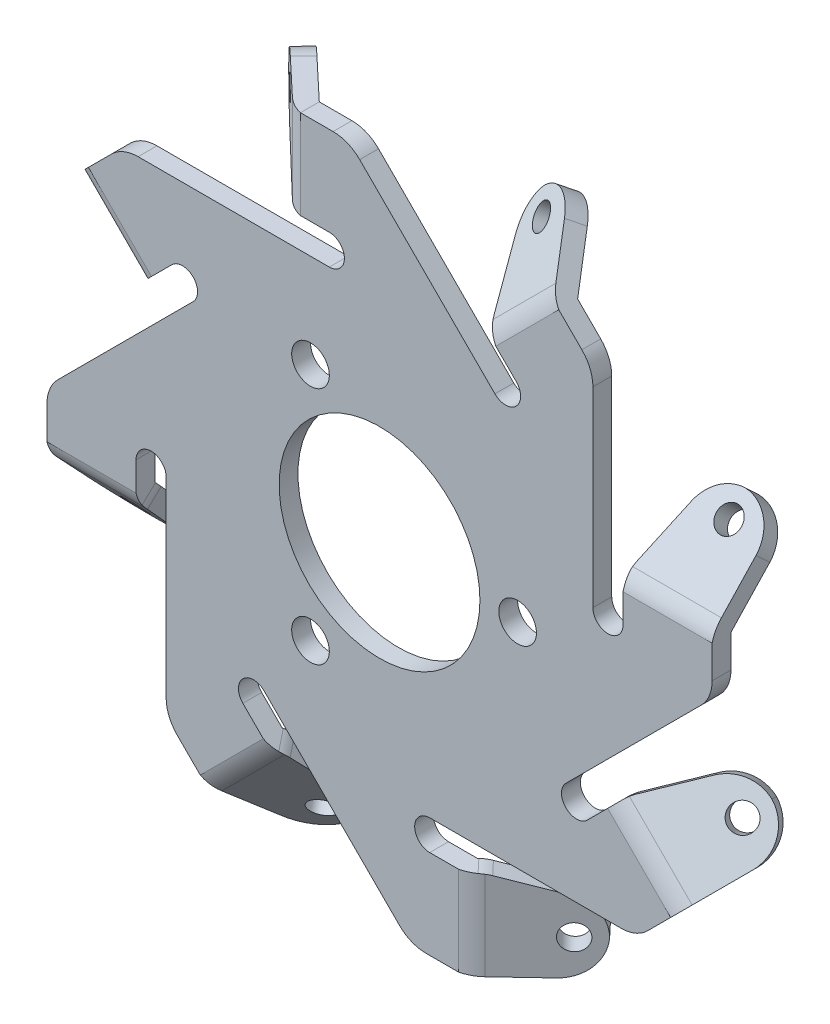
from build123d import *

# Parameters (mm, degrees)
ESQUISSE1_W                    = 53
ESQUISSE1_H                    = 53
BOSS_EXTRU_1_DEPTH             = 1.5
ESQUISSE5_R                    = 8
ENL_V_MAT_EXTRU_4_DEPTH        = 38.506666074
ENL_V_MAT_EXTRU_1_DEPTH        = 38.506666074
ESQUISSE3_W                    = 15
ESQUISSE3_H                    = 20.2
ESQUISSE3_W_2                  = 20.2
ESQUISSE3_H_2                  = 15
ENL_V_MAT_EXTRU_2_DEPTH        = 38.506666074
ENL_V_MAT_EXTRU_3_DEPTH        = 1.5
BOSS_EXTRU_2_DEPTH             = 7.1
R_P_TITION_CIRCULAIRE6_COUNT   = 8
ESQUISSE14_R                   = 1
ENL_V_MAT_EXTRU_5_DEPTH        = 44.23397886
R_P_TITION_CIRCULAIRE7_COUNT   = 8
CONG_1_R                       = 3
R_P_TITION_START               = -5.820655623
R_P_TITION_CIRCULAIRE8_DEPTH   = 1.5
R_P_TITION_CIRCULAIRE8_2_DEPTH = 1.5
R_P_TITION_START_2             = 4.320655623
R_P_TITION_CIRCULAIRE8_3_DEPTH = 1.5
R_P_TITION_CIRCULAIRE8_4_DEPTH = 1.5
R_P_TITION_CIRCULAIRE8_5_DEPTH = 1.5
R_P_TITION_CIRCULAIRE8_6_DEPTH = 1.5
R_P_TITION_CIRCULAIRE8_7_DEPTH = 1.5
CONG_2_R                       = 3
R_P_TITION_START_3             = -26.5
R_P_TITION_CIRCULAIRE9_DEPTH   = 7.1
R_P_TITION_START_4             = 19.4
R_P_TITION_CIRCULAIRE9_2_DEPTH = 7.1
R_P_TITION_CIRCULAIRE9_3_DEPTH = 7.1
R_P_TITION_CIRCULAIRE9_4_DEPTH = 7.1
R_P_TITION_CIRCULAIRE9_5_DEPTH = 7.1
R_P_TITION_CIRCULAIRE9_6_DEPTH = 7.1
R_P_TITION_CIRCULAIRE9_7_DEPTH = 7.1
CONG_3_R                       = 3
R_P_TITION_CIRCULAIRE10_DEPTH  = 1.5
ESQUISSE15_R                   = 1.5
ENL_V_MAT_EXTRU_6_DEPTH        = 39.393130179


# Read off the part's stored shape, not the designer's step: Répétition circulaire8, Répétition circulaire9, Répétition circulaire10
with BuildPart() as part:
    # Esquisse1 → Boss.-Extru.1 (new body)
    with BuildSketch(Plane.XY):
        Rectangle(ESQUISSE1_W, ESQUISSE1_H)
    extrude(amount=BOSS_EXTRU_1_DEPTH)

    # Esquisse5 → Enlèv. mat.-Extru.4 (cut, through all)
    with BuildSketch(Plane.XY.offset(1.5)):
        Circle(ESQUISSE5_R)
    extrude(amount=-ENL_V_MAT_EXTRU_4_DEPTH, mode=Mode.SUBTRACT)

    # Esquisse2 → Enlèv. mat.-Extru.1 (cut, through all)
    with BuildSketch(Plane.XY.offset(1.5)):
        with BuildLine():
            Line((19.4, 26.5), (19.4, 4))
            ThreePointArc((19.4, 4), (18.2, 2.8), (17, 4))
            Line((17, 4), (17, 26.5))
            ThreePointArc((17, 26.5), (18.2, 27.7), (19.4, 26.5))
        make_face()
        with BuildLine():
            Line((32.456201256, 5.020458146), (16.54629868, -10.88944443))
            ThreePointArc((16.54629868, -10.88944443), (14.849242405, -10.88944443), (14.849242405, -9.192388155))
            Line((14.849242405, -9.192388155), (30.759144982, 6.717514421))
            ThreePointArc((30.759144982, 6.717514421), (32.456201256, 6.717514421), (32.456201256, 5.020458146))
        make_face()
        with BuildLine():
            Line((26.5, -19.4), (4, -19.4))
            ThreePointArc((4, -19.4), (2.8, -18.2), (4, -17))
            Line((4, -17), (26.5, -17))
            ThreePointArc((26.5, -17), (27.7, -18.2), (26.5, -19.4))
        make_face()
        with BuildLine():
            Line((5.020458146, -32.456201256), (-10.88944443, -16.54629868))
            ThreePointArc((-10.88944443, -16.54629868), (-10.88944443, -14.849242405), (-9.192388155, -14.849242405))
            Line((-9.192388155, -14.849242405), (6.717514421, -30.759144982))
            ThreePointArc((6.717514421, -30.759144982), (6.717514421, -32.456201256), (5.020458146, -32.456201256))
        make_face()
        with BuildLine():
            Line((-19.4, -26.5), (-19.4, -4))
            ThreePointArc((-19.4, -4), (-18.2, -2.8), (-17, -4))
            Line((-17, -4), (-17, -26.5))
            ThreePointArc((-17, -26.5), (-18.2, -27.7), (-19.4, -26.5))
        make_face()
        with BuildLine():
            Line((-32.456201256, -5.020458146), (-16.54629868, 10.88944443))
            ThreePointArc((-16.54629868, 10.88944443), (-14.849242405, 10.88944443), (-14.849242405, 9.192388155))
            Line((-14.849242405, 9.192388155), (-30.759144982, -6.717514421))
            ThreePointArc((-30.759144982, -6.717514421), (-32.456201256, -6.717514421), (-32.456201256, -5.020458146))
        make_face()
        with BuildLine():
            Line((-26.5, 19.4), (-4, 19.4))
            ThreePointArc((-4, 19.4), (-2.8, 18.2), (-4, 17))
            Line((-4, 17), (-26.5, 17))
            ThreePointArc((-26.5, 17), (-27.7, 18.2), (-26.5, 19.4))
        make_face()
        with BuildLine():
            Line((-5.020458146, 32.456201256), (10.88944443, 16.54629868))
            ThreePointArc((10.88944443, 16.54629868), (10.88944443, 14.849242405), (9.192388155, 14.849242405))
            Line((9.192388155, 14.849242405), (-6.717514421, 30.759144982))
            ThreePointArc((-6.717514421, 30.759144982), (-6.717514421, 32.456201256), (-5.020458146, 32.456201256))
        make_face()
    extrude(amount=-ENL_V_MAT_EXTRU_1_DEPTH, mode=Mode.SUBTRACT)

    # Esquisse3 → Enlèv. mat.-Extru.2 (cut, through all)
    with BuildSketch(Plane.XY.offset(1.5)):
        with Locations((26.9, 16.4)):
            Rectangle(ESQUISSE3_W, ESQUISSE3_H)
        Polygon((18.172644276, -9.263098834), (28.779245994, -19.869700551), (43.062802974, -5.586143571), (32.456201256, 5.020458146), align=None)
        with Locations((16.4, -26.9)):
            Rectangle(ESQUISSE3_W_2, ESQUISSE3_H_2)
        Polygon((-9.263098834, -18.172644276), (-19.869700551, -28.779245994), (-5.586143571, -43.062802974), (5.020458146, -32.456201256), align=None)
        with Locations((-26.9, -16.4)):
            Rectangle(ESQUISSE3_W, ESQUISSE3_H)
        Polygon((-18.172644276, 9.263098834), (-28.779245994, 19.869700551), (-43.062802974, 5.586143571), (-32.456201256, -5.020458146), align=None)
        with Locations((-16.4, 26.9)):
            Rectangle(ESQUISSE3_W_2, ESQUISSE3_H_2)
        Polygon((9.263098834, 18.172644276), (19.869700551, 28.779245994), (5.586143571, 43.062802974), (-5.020458146, 32.456201256), align=None)
    extrude(amount=-ENL_V_MAT_EXTRU_2_DEPTH, mode=Mode.SUBTRACT)

    # Esquisse4 → Enlèv. mat.-Extru.3 (cut)
    with BuildSketch(Plane.XY.offset(1.5)):
        Polygon((14.28355698, 23.193102423), (18.526197667, 18.950461736), (22.768838354, 23.193102423), (18.526197667, 27.43574311), align=None)
        Polygon((27.43574311, -18.526197667), (23.193102423, -14.28355698), (18.950461736, -18.526197667), (23.193102423, -22.768838354), align=None)
        Polygon((-18.526197667, -27.43574311), (-14.28355698, -23.193102423), (-18.526197667, -18.950461736), (-22.768838354, -23.193102423), align=None)
        Polygon((-27.43574311, 18.526197667), (-23.193102423, 14.28355698), (-18.950461736, 18.526197667), (-23.193102423, 22.768838354), align=None)
    extrude(amount=-ENL_V_MAT_EXTRU_3_DEPTH, mode=Mode.SUBTRACT)


with BuildPart() as body_2:
    # Esquisse6 → Boss.-Extru.2 (new body)
    with BuildSketch(Plane(origin=(0, 26.5, 0), x_dir=(1, 0, 0), z_dir=(0, 1, 0))):
        Polygon((-6.3, 0), (-11.758295682, 5.143637647), (-12.787023212, 4.05197851), (-6.895406731, -1.5), (-6.3, -1.5), align=None)
    boss_extru_2 = extrude(amount=-BOSS_EXTRU_2_DEPTH)

    # Esquisse14 → Enlèv. mat.-Extru.5 (cut, through all)
    with BuildSketch(Plane(origin=(-3.991912453, 0, 4.236114594), x_dir=(0.7277727576572095, 0, 0.6858183529273774), z_dir=(-0.6858183529273774, 0, 0.7277727576572095))):
        with Locations((-10.084968373, 23.664285714)):
            Circle(ESQUISSE14_R)
        Polygon((-5.084968373, 19.4), (-12.084968373, 21.4), (-12.084968373, 19.4), align=None)
    enl_v_mat_extru_5 = extrude(amount=-ENL_V_MAT_EXTRU_5_DEPTH, mode=Mode.SUBTRACT)

    # Congé1
    # the kernel refuses this fillet: 3 mm, written as the material it takes off along each edge
    with BuildSketch(Plane(origin=(-8.413005794, 19.4, 1.51321126), x_dir=(-0.6997709349280078, 0.2747211278973797, -0.6594307700712588), z_dir=(0.6858183529273774, 0, -0.7277727576572095))) as cong_1_piece_1:
        with BuildLine():
            CenterArc((CONG_1_R * 0.14005494464, CONG_1_R), CONG_1_R, 254.054604099, 15.945395901)
            Line((-CONG_1_R * 0.134666183257, CONG_1_R * 0.0384760523592), (0, 0))
            Line((0, 0), (CONG_1_R * 0.14005494464, 0))
        make_face()
    extrude(amount=3.60082417, mode=Mode.SUBTRACT)
    with BuildSketch(Plane(origin=(-6.614658035, 26.5, -10.601933329), x_dir=(0.7277727576572104, 0, 0.6858183529273763), z_dir=(-0.6858183529273764, 0, 0.7277727576572105))) as cong_1_piece_2:
        with BuildLine():
            CenterArc((CONG_1_R, -CONG_1_R), CONG_1_R, 90, 90)
            Line((0, -CONG_1_R), (0, 0))
            Line((0, 0), (CONG_1_R, 0))
        make_face()
    extrude(amount=16.5, mode=Mode.SUBTRACT)
    with BuildSketch(Plane(origin=(-16.666876356, 21.4, 0.065221634), x_dir=(0, 1, 0), z_dir=(0.6858183529273774, 0, -0.7277727576572095))) as cong_1_piece_3:
        with BuildLine():
            CenterArc((CONG_1_R * 0.754301412754, CONG_1_R), CONG_1_R, 195.945395901, 74.054604099)
            Line((-CONG_1_R * 0.207222534886, CONG_1_R * 0.725278872103), (0, 0))
            Line((0, 0), (CONG_1_R * 0.754301412754, 0))
        make_face()
    extrude(amount=12.814521191, mode=Mode.SUBTRACT)

    # Congé2
    # the kernel refuses this fillet: 3 mm, written as the material it takes off along each edge
    with BuildSketch(Plane(origin=(-6.895406731, 29.194348497, 1.5), x_dir=(1, 0, 0), z_dir=(0, -1, 0))) as cong_2_piece_1:
        with BuildLine():
            CenterArc((1.273105684, -2.922451732), CONG_2_R, 103.055786516, 30.244213484)
            Line((-0.784349374, -0.739133459), (-0.825498476, -0.695467094))
            Line((-0.825498476, -0.695467094), (-0.041149101, 0.043666365))
            Line((-0.041149101, 0.043666365), (0, 0.06))
            ThreePointArc((0, 0.06), (0.297703365, 0.06), (0.581852752, 0.058449035))
            Line((0.581852752, 0.058449035), (0.595406731, 0))
        make_face()
    extrude(amount=12.488696995, mode=Mode.SUBTRACT)


with BuildPart() as part_1:
    add(part.part)

    # Répétition circulaire6: Boss.-Extru.2 ×8 about axis
    r_p_tition_circulaire6_axis = Axis((0, 0, 0), (0, 0, 1))
    for i in range(1, R_P_TITION_CIRCULAIRE6_COUNT):
        add(boss_extru_2.rotate(r_p_tition_circulaire6_axis, i * 360 / R_P_TITION_CIRCULAIRE6_COUNT))

    # Répétition circulaire7: Enlèv. mat.-Extru.5 ×8 about axis
    r_p_tition_circulaire7_axis = Axis((0, 0, 0), (0, 0, 1))
    for i in range(1, R_P_TITION_CIRCULAIRE7_COUNT):
        add(enl_v_mat_extru_5.rotate(r_p_tition_circulaire7_axis, i * 360 / R_P_TITION_CIRCULAIRE7_COUNT), mode=Mode.SUBTRACT)

    # Répétition circulaire8 outline → Répétition circulaire8 (cut)
    with BuildSketch(Plane(origin=(0, 0, 0), x_dir=(0.8745436486499637, -0.26890985597922773, 0.40356027550198764), z_dir=(0.4849468080171361, 0.4849468080171381, -0.7277727576572101)).offset(R_P_TITION_START)):
        with BuildLine():
            ThreePointArc((-26.177216042, -4.105846504), (-24.386324296, -3.579926665), (-22.631081143, -4.214754514))
            Line((-22.631081143, -4.214754514), (-24.414067393, -2.821307126))
            Line((-24.414067393, -2.821307126), (-28.537640401, -5.822331225))
            Line((-28.537640401, -5.822331225), (-26.772332108, -8.247962407))
            ThreePointArc((-26.772332108, -8.247962407), (-27.316208691, -6.056011832), (-26.177216042, -4.105846504))
        make_face()
        with BuildLine():
            Line((-18.677927253, -7.30424102), (-19.008983296, -7.045512621))
            ThreePointArc((-19.008983296, -7.045512621), (-18.698982985, -7.324587663), (-18.430687098, -7.64396266))
            Line((-18.430687098, -7.64396266), (-18.677927253, -7.30424102))
        make_face()
    extrude(amount=R_P_TITION_CIRCULAIRE8_DEPTH, mode=Mode.SUBTRACT)

    # R_p_tition circulaire8 2 outline → R_p_tition circulaire8 2 (cut)
    with BuildSketch(Plane(origin=(0, 0, 0), x_dir=(1, 0, 0), z_dir=(0, 0.6858183529273764, -0.7277727576572104)).offset(R_P_TITION_START)):
        with BuildLine():
            ThreePointArc((-23.581452119, 12.083862428), (-21.823967614, 11.455266264), (-20.778332395, 9.909131757))
            Line((-20.778332395, 9.909131757), (-21.4, 12.084968373))
            Line((-21.4, 12.084968373), (-26.5, 12.084968373))
            Line((-26.5, 12.084968373), (-26.5, 9.084968373))
            ThreePointArc((-26.5, 9.084968373), (-25.649925157, 11.177292875), (-23.581452119, 12.083862428))
        make_face()
        with BuildLine():
            Line((-19.4, 5.084968373), (-19.515428157, 5.488966923))
            ThreePointArc((-19.515428157, 5.488966923), (-19.428997179, 5.080907175), (-19.4, 4.664803539))
            Line((-19.4, 4.664803539), (-19.4, 5.084968373))
        make_face()
    extrude(amount=R_P_TITION_CIRCULAIRE8_2_DEPTH, mode=Mode.SUBTRACT)

    # R_p_tition circulaire8 3 outline → R_p_tition circulaire8 3 (cut)
    with BuildSketch(Plane(origin=(0, 0, 0), x_dir=(0.8745436486499614, 0.26890985597922834, -0.40356027550199197), z_dir=(0.4849468080171401, -0.4849468080171341, 0.7277727576572101)).offset(R_P_TITION_START_2)):
        with BuildLine():
            Line((-10.191604126, -22.363757867), (-10.969299493, -20.23868716))
            ThreePointArc((-10.969299493, -20.23868716), (-10.904939933, -22.104094024), (-11.956054331, -23.646508834))
            ThreePointArc((-11.956054331, -23.646508834), (-14.16196348, -24.130671912), (-16.080485428, -22.939150785))
            Line((-16.080485428, -22.939150785), (-14.315177135, -25.364781966))
            Line((-14.315177135, -25.364781966), (-10.191604126, -22.363757867))
        make_face()
        with BuildLine():
            ThreePointArc((-12.940809513, -15.18735794), (-12.7194046, -15.540858911), (-12.54917074, -15.921652168))
            Line((-12.54917074, -15.921652168), (-12.693569358, -15.527079581))
            Line((-12.693569358, -15.527079581), (-12.940809513, -15.18735794))
        make_face()
    extrude(amount=R_P_TITION_CIRCULAIRE8_3_DEPTH, mode=Mode.SUBTRACT)

    # R_p_tition circulaire8 4 outline → R_p_tition circulaire8 4 (cut)
    with BuildSketch(Plane(origin=(0, 0, 0), x_dir=(0.7277727576572104, 0, -0.6858183529273765), z_dir=(0.6858183529273764, 0, 0.7277727576572104)).offset(R_P_TITION_START_2)):
        with BuildLine():
            Line((12.084968373, -21.4), (9.909131757, -20.778332395))
            ThreePointArc((9.909131757, -20.778332395), (11.455266264, -21.823967614), (12.083862428, -23.581452119))
            ThreePointArc((12.083862428, -23.581452119), (11.177292875, -25.649925157), (9.084968373, -26.5))
            Line((9.084968373, -26.5), (12.084968373, -26.5))
            Line((12.084968373, -26.5), (12.084968373, -21.4))
        make_face()
        with BuildLine():
            ThreePointArc((4.664803539, -19.4), (5.080907175, -19.428997179), (5.488966923, -19.515428157))
            Line((5.488966923, -19.515428157), (5.084968373, -19.4))
            Line((5.084968373, -19.4), (4.664803539, -19.4))
        make_face()
    extrude(amount=R_P_TITION_CIRCULAIRE8_4_DEPTH, mode=Mode.SUBTRACT)

    # R_p_tition circulaire8 5 outline → R_p_tition circulaire8 5 (cut)
    with BuildSketch(Plane(origin=(0, 0, 0), x_dir=(0.8745436486499657, -0.26890985597922673, -0.4035602755019837), z_dir=(0.4849468080171323, 0.4849468080171413, 0.7277727576572104)).offset(R_P_TITION_START_2)):
        with BuildLine():
            Line((24.414067393, -2.821307126), (22.631081143, -4.214754514))
            ThreePointArc((22.631081143, -4.214754514), (24.386324296, -3.579926665), (26.177216042, -4.105846504))
            ThreePointArc((26.177216042, -4.105846504), (27.316208691, -6.056011832), (26.772332108, -8.247962407))
            Line((26.772332108, -8.247962407), (28.537640401, -5.822331225))
            Line((28.537640401, -5.822331225), (24.414067393, -2.821307126))
        make_face()
        with BuildLine():
            ThreePointArc((18.430687098, -7.64396266), (18.698982985, -7.324587663), (19.008983296, -7.045512621))
            Line((19.008983296, -7.045512621), (18.677927253, -7.30424102))
            Line((18.677927253, -7.30424102), (18.430687098, -7.64396266))
        make_face()
    extrude(amount=R_P_TITION_CIRCULAIRE8_5_DEPTH, mode=Mode.SUBTRACT)

    # R_p_tition circulaire8 6 outline → R_p_tition circulaire8 6 (cut)
    with BuildSketch(Plane(origin=(0, 0, 0), x_dir=(1, 0, 0), z_dir=(0, 0.6858183529273764, 0.7277727576572104)).offset(R_P_TITION_START_2)):
        with BuildLine():
            Line((21.4, 12.084968373), (20.778332395, 9.909131757))
            ThreePointArc((20.778332395, 9.909131757), (21.823967614, 11.455266264), (23.581452119, 12.083862428))
            ThreePointArc((23.581452119, 12.083862428), (25.649925157, 11.177292875), (26.5, 9.084968373))
            Line((26.5, 9.084968373), (26.5, 12.084968373))
            Line((26.5, 12.084968373), (21.4, 12.084968373))
        make_face()
        with BuildLine():
            ThreePointArc((19.4, 4.664803539), (19.428997179, 5.080907175), (19.515428157, 5.488966923))
            Line((19.515428157, 5.488966923), (19.4, 5.084968373))
            Line((19.4, 5.084968373), (19.4, 4.664803539))
        make_face()
    extrude(amount=R_P_TITION_CIRCULAIRE8_6_DEPTH, mode=Mode.SUBTRACT)

    # R_p_tition circulaire8 7 outline → R_p_tition circulaire8 7 (cut)
    with BuildSketch(Plane(origin=(0, 0, 0), x_dir=(0.8745436486499597, 0.26890985597922884, 0.4035602755019952), z_dir=(0.48494680801714307, -0.4849468080171311, -0.7277727576572101)).offset(R_P_TITION_START)):
        with BuildLine():
            ThreePointArc((11.956054331, -23.646508834), (10.904939933, -22.104094024), (10.969299493, -20.23868716))
            Line((10.969299493, -20.23868716), (10.191604126, -22.363757867))
            Line((10.191604126, -22.363757867), (14.315177135, -25.364781966))
            Line((14.315177135, -25.364781966), (16.080485428, -22.939150785))
            ThreePointArc((16.080485428, -22.939150785), (14.16196348, -24.130671912), (11.956054331, -23.646508834))
        make_face()
        with BuildLine():
            Line((12.693569358, -15.527079581), (12.54917074, -15.921652168))
            ThreePointArc((12.54917074, -15.921652168), (12.7194046, -15.540858911), (12.940809513, -15.18735794))
            Line((12.940809513, -15.18735794), (12.693569358, -15.527079581))
        make_face()
    extrude(amount=R_P_TITION_CIRCULAIRE8_7_DEPTH, mode=Mode.SUBTRACT)

    # Répétition circulaire9 outline → Répétition circulaire9 (cut)
    with BuildSketch(Plane(origin=(0, 0, 0), x_dir=(0.707106781186546, 0.707106781186549, 0), z_dir=(0.707106781186549, -0.707106781186546, 0)).offset(R_P_TITION_START_3)):
        with BuildLine():
            Line((-6.895406731, 1.5), (-7.679756105, 0.760866541))
            ThreePointArc((-7.679756105, 0.760866541), (-7.038933121, 1.222005407), (-6.3, 1.5))
            Line((-6.3, 1.5), (-6.895406731, 1.5))
        make_face()
    extrude(amount=R_P_TITION_CIRCULAIRE9_DEPTH, mode=Mode.SUBTRACT)

    # R_p_tition circulaire9 2 outline → R_p_tition circulaire9 2 (cut)
    with BuildSketch(Plane(origin=(0, 0, 0), x_dir=(0.707106781186546, 0.707106781186549, 0), z_dir=(0.707106781186549, -0.707106781186546, 0)).offset(R_P_TITION_START_4)):
        with BuildLine():
            Line((6.895406731, 1.5), (6.3, 1.5))
            ThreePointArc((6.3, 1.5), (7.038933121, 1.222005407), (7.679756105, 0.760866541))
            Line((7.679756105, 0.760866541), (6.895406731, 1.5))
        make_face()
    extrude(amount=R_P_TITION_CIRCULAIRE9_2_DEPTH, mode=Mode.SUBTRACT)

    # R_p_tition circulaire9 3 outline → R_p_tition circulaire9 3 (cut)
    with BuildSketch(Plane.YZ.offset(R_P_TITION_START_3)):
        with BuildLine():
            Line((-6.895406731, 1.5), (-7.679756105, 0.760866541))
            ThreePointArc((-7.679756105, 0.760866541), (-7.038933121, 1.222005407), (-6.3, 1.5))
            Line((-6.3, 1.5), (-6.895406731, 1.5))
        make_face()
    extrude(amount=R_P_TITION_CIRCULAIRE9_3_DEPTH, mode=Mode.SUBTRACT)

    # R_p_tition circulaire9 4 outline → R_p_tition circulaire9 4 (cut)
    with BuildSketch(Plane.YZ.offset(R_P_TITION_START_4)):
        with BuildLine():
            Line((6.895406731, 1.5), (6.3, 1.5))
            ThreePointArc((6.3, 1.5), (7.038933121, 1.222005407), (7.679756105, 0.760866541))
            Line((7.679756105, 0.760866541), (6.895406731, 1.5))
        make_face()
    extrude(amount=R_P_TITION_CIRCULAIRE9_4_DEPTH, mode=Mode.SUBTRACT)

    # R_p_tition circulaire9 5 outline → R_p_tition circulaire9 5 (cut)
    with BuildSketch(Plane(origin=(0, 0, 0), x_dir=(0.7071067811865509, -0.707106781186544, 0), z_dir=(0.707106781186544, 0.707106781186551, 0)).offset(R_P_TITION_START_3)):
        with BuildLine():
            Line((6.895406731, -1.5), (7.679756105, -0.760866541))
            ThreePointArc((7.679756105, -0.760866541), (7.038933121, -1.222005407), (6.3, -1.5))
            Line((6.3, -1.5), (6.895406731, -1.5))
        make_face()
    extrude(amount=R_P_TITION_CIRCULAIRE9_5_DEPTH, mode=Mode.SUBTRACT)

    # R_p_tition circulaire9 6 outline → R_p_tition circulaire9 6 (cut)
    with BuildSketch(Plane(origin=(0, 0, 0), x_dir=(0.7071067811865509, -0.707106781186544, 0), z_dir=(0.707106781186544, 0.707106781186551, 0)).offset(R_P_TITION_START_4)):
        with BuildLine():
            Line((-6.895406731, -1.5), (-6.3, -1.5))
            ThreePointArc((-6.3, -1.5), (-7.038933121, -1.222005407), (-7.679756105, -0.760866541))
            Line((-7.679756105, -0.760866541), (-6.895406731, -1.5))
        make_face()
    extrude(amount=R_P_TITION_CIRCULAIRE9_6_DEPTH, mode=Mode.SUBTRACT)

    # R_p_tition circulaire9 7 outline → R_p_tition circulaire9 7 (cut)
    with BuildSketch(Plane(origin=(0, 0, 0), x_dir=(1, 0, 0), z_dir=(0, 1, 0)).offset(R_P_TITION_START_3)):
        with BuildLine():
            Line((6.895406731, -1.5), (7.679756105, -0.760866541))
            ThreePointArc((7.679756105, -0.760866541), (7.038933121, -1.222005407), (6.3, -1.5))
            Line((6.3, -1.5), (6.895406731, -1.5))
        make_face()
    extrude(amount=R_P_TITION_CIRCULAIRE9_7_DEPTH, mode=Mode.SUBTRACT)

    # Congé3
    cong_3_edges = [part_1.edges().sort_by_distance(p)[0] for p in [
        (-2.45836944, 26.5, 0.75),
    ]]
    fillet(cong_3_edges, radius=CONG_3_R)

    # Répétition circulaire10 outline → Répétition circulaire10 (cut)
    with BuildSketch(Plane.XY):
        with BuildLine():
            Line((-20.476659403, 17), (-21.355339059, 16.121320344))
            ThreePointArc((-21.355339059, 16.121320344), (-20.382069013, 16.771638598), (-19.234018716, 17))
            Line((-19.234018716, 17), (-20.476659403, 17))
        make_face()
        with BuildLine():
            Line((-26.5, -2.45836944), (-26.5, -3.701010127))
            ThreePointArc((-26.5, -3.701010127), (-26.271638598, -2.55295983), (-25.621320344, -1.579689783))
            Line((-25.621320344, -1.579689783), (-26.5, -2.45836944))
        make_face()
        with BuildLine():
            Line((-17, -20.476659403), (-16.121320344, -21.355339059))
            ThreePointArc((-16.121320344, -21.355339059), (-16.771638598, -20.382069013), (-17, -19.234018716))
            Line((-17, -19.234018716), (-17, -20.476659403))
        make_face()
        with BuildLine():
            Line((2.45836944, -26.5), (3.701010127, -26.5))
            ThreePointArc((3.701010127, -26.5), (2.55295983, -26.271638598), (1.579689783, -25.621320344))
            Line((1.579689783, -25.621320344), (2.45836944, -26.5))
        make_face()
        with BuildLine():
            Line((20.476659403, -17), (21.355339059, -16.121320344))
            ThreePointArc((21.355339059, -16.121320344), (20.382069013, -16.771638598), (19.234018716, -17))
            Line((19.234018716, -17), (20.476659403, -17))
        make_face()
        with BuildLine():
            Line((26.5, 2.45836944), (26.5, 3.701010127))
            ThreePointArc((26.5, 3.701010127), (26.271638598, 2.55295983), (25.621320344, 1.579689783))
            Line((25.621320344, 1.579689783), (26.5, 2.45836944))
        make_face()
        with BuildLine():
            Line((17, 20.476659403), (16.121320344, 21.355339059))
            ThreePointArc((16.121320344, 21.355339059), (16.771638598, 20.382069013), (17, 19.234018716))
            Line((17, 19.234018716), (17, 20.476659403))
        make_face()
    extrude(amount=R_P_TITION_CIRCULAIRE10_DEPTH, mode=Mode.SUBTRACT)

    # Esquisse15 → Enlèv. mat.-Extru.6 (cut, through all)
    with BuildSketch(Plane.XY.offset(1.5)):
        with Locations((11, 0)):
            Circle(ESQUISSE15_R)
        with Locations((-5.5, -9.526279442)):
            Circle(ESQUISSE15_R)
        with Locations((-5.5, 9.526279442)):
            Circle(ESQUISSE15_R)
    extrude(amount=-ENL_V_MAT_EXTRU_6_DEPTH, mode=Mode.SUBTRACT)


solid = Compound([body_2.part, part_1.part])
